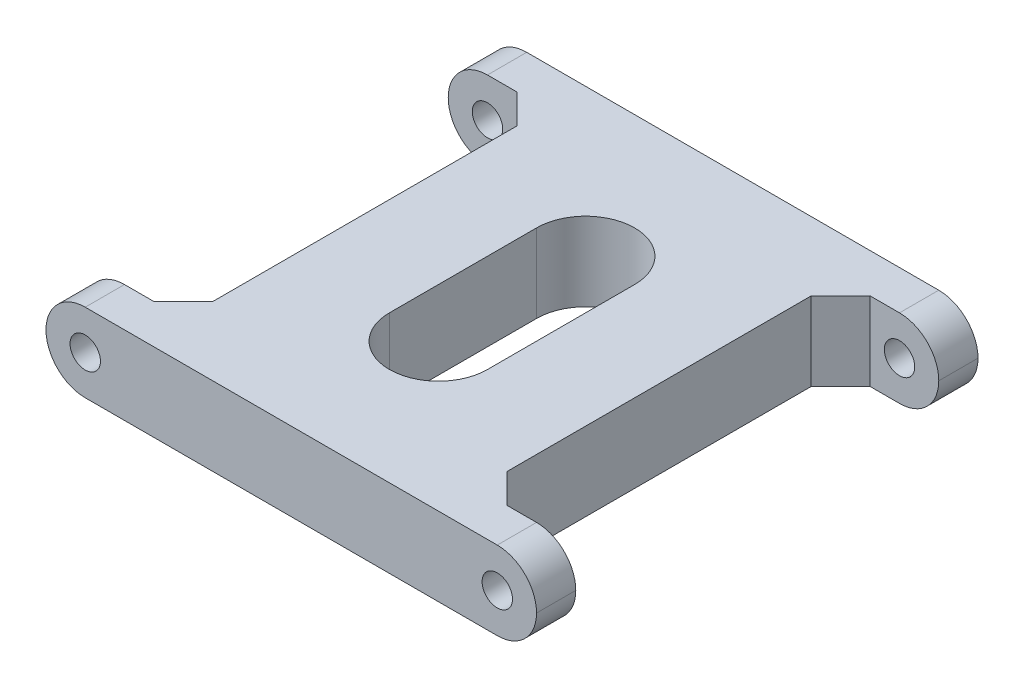
from build123d import *

# Parameters (mm, degrees)
BOSS_EXTRUDE1_DEPTH     = 4
CHAMFER1_SIZE           = 3
CUT_EXTRUDE1_DEPTH      = 34.871079109
CUT_EXTRUDE1_DEPTH_BACK = 34.871079109
SKETCH3_R               = 1.55
FILLET1_R               = 4


with BuildPart() as part:
    # Sketch1 → Boss-Extrude1 (new, symmetric)
    with BuildSketch(Plane(origin=(0, 0, 0), x_dir=(1, 0, 0), z_dir=(0, 1, 0))):
        Polygon((-25, 22.5), (25, 22.5), (25, 18.5), (15, 18.5), (15, -18.5), (25, -18.5), (25, -22.5), (-25, -22.5), (-25, -18.5), (-15, -18.5), (-15, 18.5), (-25, 18.5), align=None)
        with BuildLine():
            Line((-5, -7.5), (-5, 7.5))
            ThreePointArc((-5, 7.5), (0, 12.5), (5, 7.5))
            Line((5, 7.5), (5, -7.5))
            ThreePointArc((5, -7.5), (0, -12.5), (-5, -7.5))
        make_face(mode=Mode.SUBTRACT)
    extrude(amount=BOSS_EXTRUDE1_DEPTH, both=True)

    # Chamfer1
    chamfer1_edges = [part.edges().sort_by_distance(p)[0] for p in [
        (-15, 0, 18.5),
        (-15, 0, -18.5),
        (15, 0, -18.5),
        (15, 0, 18.5),
    ]]
    chamfer(chamfer1_edges, length=CHAMFER1_SIZE)

    # Sketch3 → Cut-Extrude1 (cut, two sides: drawn at the far end of the back side and taken through both)
    with BuildSketch(Plane.XY.offset(-CUT_EXTRUDE1_DEPTH_BACK)):
        with Locations((-21, 0)):
            Circle(SKETCH3_R)
        with Locations((21, 0)):
            Circle(SKETCH3_R)
    extrude(amount=CUT_EXTRUDE1_DEPTH + CUT_EXTRUDE1_DEPTH_BACK, mode=Mode.SUBTRACT)

    # Fillet1
    fillet1_edges = [part.edges().sort_by_distance(p)[0] for p in [
        (25, -4, 20.5),
        (-25, -4, 20.5),
        (-25, 4, 20.5),
        (25, 4, 20.5),
        (25, -4, -20.5),
        (25, 4, -20.5),
        (-25, -4, -20.5),
        (-25, 4, -20.5),
    ]]
    fillet(fillet1_edges, radius=FILLET1_R - 0.0001)  # a hair under: the kernel refuses the full size


solid = part.part
